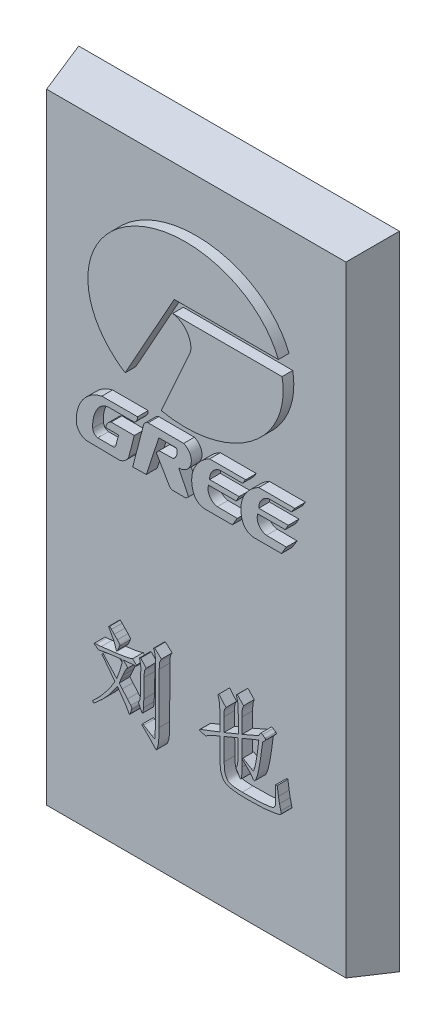
from build123d import *

# Parameters (mm, degrees)
EXTRUDE_3_DEPTH     = 1
SKETCH_5_R          = 5.5
CUT_EXTRUDE_1_DEPTH = 2
EXTRUDE_4_DEPTH     = 1
EXTRUDE_5_DEPTH     = 1


with BuildPart() as part:
    # 草图1 → 放样1 section 0
    with BuildSketch(Plane.XY):
        with BuildLine():
            Line((-15, -30), (15, -30))
            Line((15, -30), (15, 30))
            Line((15, 30), (-15, 30))
            Line((-15, 30), (-15, -30))
        make_face()
    # 草图2 → 放样1 section 1
    with BuildSketch(Plane.XY.offset(4)):
        with BuildLine():
            Line((-14, -29), (14, -29))
            Line((14, -29), (14, 29))
            Line((14, 29), (-14, 29))
            Line((-14, 29), (-14, -29))
        make_face()
    loft()

    # 草图4 → 凸台-拉伸3 (add)
    with BuildSketch(Plane.XY.offset(4)):
        with BuildLine():
            Line((-8.701981675, -17.388663968), (-8.617600682, -17.301725975))
            add(Edge.make_bspline(
                [(-8.617600682, -17.301725975), (-8.6150409, -17.299171838), (-8.607361553, -17.291509428), (-8.591939025, -17.275812111), (-8.567531532, -17.253359072), (-8.535647603, -17.222146979), (-8.494553267, -17.183979196), (-8.445204463, -17.138285053), (-8.386816782, -17.085481715), (-8.320576955, -17.024306793), (-8.246221878, -16.954193648), (-8.165436054, -16.873388622), (-8.079020214, -16.781225902), (-7.985588416, -16.679014982), (-7.886121691, -16.565894731), (-7.778094687, -16.443997551), (-7.666436292, -16.308719395), (-7.503591424, -16.115000087), (-7.298895179, -15.854174622), (-7.06301416, -15.517669226), (-6.830626913, -15.160132218), (-6.685534688, -14.909472229), (-6.611634349, -14.781802685)],
                knots=[0, 0, 0, 0, 0.067064899, 0.201194698, 0.408053647, 0.681959008, 1.028641223, 1.448132034, 1.929283414, 2.488604495, 3.120354818, 3.824536261, 4.607279378, 5.463251305, 6.392664243, 7.400870751, 8.483674113, 9.645406679, 12.094487374, 14.629448405, 17.264597856, 20, 20, 20, 20], degree=3))
            add(Edge.make_bspline(
                [(-6.611634349, -14.781802685), (-6.677355219, -14.694080325), (-6.801336137, -14.528594101), (-6.975046697, -14.293869871), (-7.128052851, -14.089741633), (-7.260480444, -13.915569528), (-7.369897523, -13.770279599), (-7.457376329, -13.654282983), (-7.526217285, -13.570571896), (-7.582699071, -13.497799136), (-7.635586412, -13.437186854), (-7.679234592, -13.378243521), (-7.712283472, -13.338932475), (-7.724576877, -13.315079833), (-7.729043256, -13.306413808)],
                knots=[0, 0, 0, 0, 2.13149326, 4.021013283, 5.678471046, 7.092298062, 8.275727547, 9.215558715, 9.917047241, 10.382981583, 11.006899411, 11.479347563, 11.810839116, 12, 12, 12, 12], degree=3))
            Line((-7.729043256, -13.306413808), (-7.824930748, -13.177285319))
            Line((-7.824930748, -13.177285319), (-7.729043256, -13.073726827))
            Line((-7.729043256, -13.073726827), (-7.644662263, -13.15938632))
            add(Edge.make_bspline(
                [(-7.644662263, -13.15938632), (-7.629282451, -13.175972122), (-7.591954382, -13.216227229), (-7.527305195, -13.288297956), (-7.440557184, -13.379422665), (-7.302378255, -13.536292511), (-7.104572099, -13.745740062), (-6.905065826, -13.963796689), (-6.747802954, -14.136718021), (-6.635049858, -14.252099447), (-6.536865705, -14.358806964), (-6.47286159, -14.423973045), (-6.442872363, -14.454506712)],
                knots=[0, 0, 0, 0, 0.384045172, 0.932109217, 1.643764177, 2.519898478, 4.481024401, 6.534588103, 7.538259206, 8.449228042, 9.273383417, 10, 10, 10, 10], degree=3))
            add(Edge.make_bspline(
                [(-6.442872363, -14.454506712), (-6.405201527, -14.35911478), (-6.332905522, -14.176043302), (-6.231843181, -13.912276932), (-6.149864716, -13.668866252), (-6.078665366, -13.450308489), (-6.024339358, -13.258168598), (-5.98424666, -13.096326335), (-5.956943752, -12.966798323), (-5.95252254, -12.890132643), (-5.950649904, -12.857660345)],
                knots=[0, 0, 0, 0, 1.468618142, 2.818499293, 4.043910366, 5.145864078, 6.10981738, 6.901638294, 7.534781031, 8, 8, 8, 8], degree=3))
            Line((-5.950649904, -12.857660345), (-5.950649904, -12.667163861))
            Line((-5.950649904, -12.667163861), (-6.972171319, -12.788621351))
            Line((-6.972171319, -12.788621351), (-7.451608779, -12.857660345))
            Line((-7.451608779, -12.857660345), (-7.956616237, -12.952269337))
            Line((-7.956616237, -12.952269337), (-8.16117622, -12.995738334))
            Line((-8.16117622, -12.995738334), (-8.232772214, -12.935648839))
            Line((-8.232772214, -12.935648839), (-8.485915193, -12.745152355))
            add(Edge.make_bspline(
                [(-8.485915193, -12.745152355), (-8.501489303, -12.73490888), (-8.526447886, -12.718493008), (-8.558458879, -12.694799587), (-8.557568147, -12.661889169), (-8.50827822, -12.649271695), (-8.449453901, -12.63496461), (-8.393937078, -12.628338983), (-8.365736203, -12.624973365)],
                knots=[0, 0, 0, 0, 1.118768377, 1.792903396, 2.169548065, 2.763492425, 4.355951528, 6, 6, 6, 6], degree=3))
            Line((-8.365736203, -12.624973365), (-7.885020243, -12.590453867))
            add(Edge.make_bspline(
                [(-7.885020243, -12.590453867), (-7.78272737, -12.578629672), (-7.574258285, -12.5545324), (-7.256024754, -12.515654208), (-6.925643087, -12.476441077), (-6.701543082, -12.448642762), (-6.587342851, -12.43447688)],
                knots=[0, 0, 0, 0, 0.945420497, 1.926731945, 2.943473063, 4, 4, 4, 4], degree=3))
            add(Edge.make_bspline(
                [(-6.587342851, -12.43447688), (-6.495657729, -12.423413493), (-6.318882537, -12.402082524), (-6.064664904, -12.364158296), (-5.830515798, -12.327688901), (-5.617264447, -12.28984122), (-5.424834911, -12.249462361), (-5.25244094, -12.211336739), (-5.101225844, -12.169009917), (-5.008293553, -12.13818563), (-4.964926486, -12.123801406)],
                knots=[0, 0, 0, 0, 1.33948248, 2.582613925, 3.727962399, 4.776813962, 5.723648299, 6.579883267, 7.337299279, 8, 8, 8, 8], degree=3))
            Line((-4.964926486, -12.123801406), (-4.592883017, -12.44342638))
            add(Edge.make_bspline(
                [(-4.592883017, -12.44342638), (-4.586313661, -12.454610374), (-4.573704208, -12.476077324), (-4.578676747, -12.511884126), (-4.596688819, -12.541911053), (-4.618071593, -12.545302265), (-4.628681014, -12.546984871)],
                knots=[0, 0, 0, 0, 1.123791349, 2.157044512, 3.08558681, 4, 4, 4, 4], degree=3))
            Line((-4.628681014, -12.546984871), (-5.193777967, -12.590453867))
            Line((-5.193777967, -12.590453867), (-5.793394417, -12.650543362))
            Line((-5.793394417, -12.650543362), (-5.409844449, -13.099296825))
            add(Edge.make_bspline(
                [(-5.409844449, -13.099296825), (-5.449499903, -13.136079122), (-5.524000558, -13.205181979), (-5.587303376, -13.301744233), (-5.61998484, -13.37159487), (-5.641445696, -13.416701743), (-5.666890063, -13.471734749), (-5.696865722, -13.536256466), (-5.729756683, -13.61142488), (-5.766306518, -13.697074488), (-5.809177744, -13.791622756), (-5.838230924, -13.858260359), (-5.853483912, -13.893245259)],
                knots=[0, 0, 0, 0, 1.762639404, 3.311468555, 3.728776672, 4.283189535, 4.943599157, 5.710021754, 6.607881863, 7.624557154, 8.752886879, 10, 10, 10, 10], degree=3))
            Line((-5.853483912, -13.893245259), (-6.082335393, -14.411037716))
            Line((-6.082335393, -14.411037716), (-6.214020882, -14.712763691))
            Line((-6.214020882, -14.712763691), (-5.926358406, -15.049009163))
            Line((-5.926358406, -15.049009163), (-5.434135947, -15.610270616))
            Line((-5.434135947, -15.610270616), (-5.120903473, -15.973364586))
            add(Edge.make_bspline(
                [(-5.120903473, -15.973364586), (-5.108508398, -15.990363114), (-5.086163173, -16.021007216), (-5.056993841, -16.062275096), (-5.040222812, -16.096032898), (-5.029672316, -16.123584455), (-5.031655384, -16.152962114), (-5.034721662, -16.189376311), (-5.04632312, -16.236994653), (-5.055631797, -16.272143528), (-5.060813978, -16.291711059)],
                knots=[0, 0, 0, 0, 1.455215602, 2.623390349, 3.479583614, 4.066449285, 4.626074215, 5.48479686, 6.599775501, 8, 8, 8, 8], degree=3))
            Line((-5.060813978, -16.291711059), (-5.169486469, -16.663754528))
            add(Edge.make_bspline(
                [(-5.169486469, -16.663754528), (-5.174174993, -16.677157718), (-5.18246774, -16.700864381), (-5.198745873, -16.729886481), (-5.216901029, -16.749122095), (-5.238951481, -16.755125572), (-5.261594893, -16.748983909), (-5.282282348, -16.729450325), (-5.305362329, -16.7015698), (-5.3182664, -16.677293999), (-5.325463456, -16.663754528)],
                knots=[0, 0, 0, 0, 1.365122435, 2.414536923, 3.199116316, 3.836643909, 4.513934304, 5.360547298, 6.527884014, 8, 8, 8, 8], degree=3))
            Line((-5.325463456, -16.663754528), (-5.421350948, -16.482207543))
            Line((-5.421350948, -16.482207543), (-5.565821436, -16.215001065))
            add(Edge.make_bspline(
                [(-5.565821436, -16.215001065), (-5.572208548, -16.205622117), (-5.588244401, -16.182074784), (-5.616983427, -16.140250866), (-5.658060685, -16.086621593), (-5.705063521, -16.017726276), (-5.763659301, -15.936783591), (-5.830878889, -15.842211073), (-5.90903839, -15.735248117), (-5.992876265, -15.619552174), (-6.075177782, -15.503789732), (-6.150436469, -15.397555707), (-6.216408063, -15.305904078), (-6.26928579, -15.226623912), (-6.312977006, -15.16243407), (-6.347040873, -15.11293019), (-6.368573488, -15.076247309), (-6.378991259, -15.056277349), (-6.382782868, -15.049009163)],
                knots=[0, 0, 0, 0, 0.382459276, 0.960224421, 1.710024245, 2.658454337, 3.770494442, 5.077894009, 6.569008607, 8.235429148, 9.893471766, 11.356158959, 12.623493842, 13.699131709, 14.567622413, 15.240873571, 15.723711415, 16, 16, 16, 16], degree=3))
            add(Edge.make_bspline(
                [(-6.382782868, -15.049009163), (-6.416909498, -15.100552505), (-6.482944033, -15.200288127), (-6.578062572, -15.345140635), (-6.670026744, -15.477861724), (-6.753098386, -15.60222334), (-6.833596009, -15.714430579), (-6.905249148, -15.8183162), (-6.973635526, -15.91004722), (-7.058115277, -16.023697045), (-7.173217897, -16.167150414), (-7.334311928, -16.346177935), (-7.520572626, -16.54609202), (-7.728276888, -16.75445262), (-7.936900177, -16.959762036), (-8.134192485, -17.142216407), (-8.308601908, -17.29845862), (-8.42121459, -17.389077999), (-8.473130194, -17.430854464)],
                knots=[0, 0, 0, 0, 0.931745548, 1.802914179, 2.611776586, 3.365396291, 4.056858392, 4.693065683, 5.267339538, 5.781210556, 6.827513186, 8.037874439, 9.410316573, 10.945546555, 12.471773758, 13.821678912, 14.99577158, 16, 16, 16, 16], degree=3))
            Line((-8.473130194, -17.430854464), (-8.606094183, -17.534412955))
            Line((-8.606094183, -17.534412955), (-8.701981675, -17.388663968))
        make_face()
        with BuildLine():
            Line((-7.211250799, -10.630513531), (-7.103856808, -10.553803537))
            Line((-7.103856808, -10.553803537), (-6.935094822, -10.726401023))
            Line((-6.935094822, -10.726401023), (-6.671723844, -10.993607501))
            Line((-6.671723844, -10.993607501), (-6.382782868, -11.295333475))
            add(Edge.make_bspline(
                [(-6.382782868, -11.295333475), (-6.364016122, -11.315776091), (-6.328925502, -11.354000303), (-6.279962873, -11.407778928), (-6.238808393, -11.454933426), (-6.206100395, -11.495820497), (-6.179781755, -11.528336484), (-6.163263547, -11.554924513), (-6.151359602, -11.573453422), (-6.145792904, -11.602262853), (-6.166926085, -11.650051026), (-6.181777032, -11.692273105), (-6.191007884, -11.71851694)],
                knots=[0, 0, 0, 0, 1.619185606, 3.027601398, 4.244025609, 5.269295413, 6.084975465, 6.67813271, 7.10086228, 7.354451259, 8.355615234, 10, 10, 10, 10], degree=3))
            Line((-6.191007884, -11.71851694), (-6.311186874, -12.029192414))
            add(Edge.make_bspline(
                [(-6.311186874, -12.029192414), (-6.321417975, -12.053246865), (-6.339637715, -12.096083488), (-6.369175367, -12.150574851), (-6.394959287, -12.188922038), (-6.420692917, -12.212351984), (-6.449964905, -12.215095714), (-6.472643068, -12.194654532), (-6.489438739, -12.160245395), (-6.497947711, -12.131683057), (-6.502961858, -12.114851907)],
                knots=[0, 0, 0, 0, 1.766026744, 3.144973943, 4.176047435, 4.895969722, 5.415113065, 5.991050895, 6.816171035, 8, 8, 8, 8], degree=3))
            Line((-6.502961858, -12.114851907), (-6.527253356, -12.029192414))
            add(Edge.make_bspline(
                [(-6.527253356, -12.029192414), (-6.565462786, -11.913018959), (-6.64149182, -11.681857287), (-6.749621634, -11.463861832), (-6.803409333, -11.35542297)],
                knots=[0, 0, 0, 0, 1.005127315, 2, 2, 2, 2], degree=3))
            Line((-6.803409333, -11.35542297), (-6.972171319, -11.053696996))
            add(Edge.make_bspline(
                [(-6.972171319, -11.053696996), (-6.993300524, -11.01673679), (-7.030051629, -10.952450019), (-7.07406915, -10.869103457), (-7.103723446, -10.815099763), (-7.112566488, -10.786565613), (-7.115363307, -10.777541019)],
                knots=[0, 0, 0, 0, 1.639141311, 2.851042099, 3.636615117, 4, 4, 4, 4], degree=3))
            Line((-7.115363307, -10.777541019), (-7.211250799, -10.630513531))
        make_face()
        with BuildLine():
            Line((-4.31544854, -11.727466439), (-4.19526955, -11.675047944))
            Line((-4.19526955, -11.675047944), (-3.691540592, -12.245258896))
            add(Edge.make_bspline(
                [(-3.691540592, -12.245258896), (-3.709810323, -12.2727357), (-3.743306609, -12.323112515), (-3.783569559, -12.394330478), (-3.813704395, -12.452101199), (-3.834694025, -12.516023227), (-3.847448468, -12.59699214), (-3.86001522, -12.684347934), (-3.866041286, -12.771519098), (-3.870153354, -12.858037951), (-3.87038165, -12.963355521), (-3.871309223, -13.040061953), (-3.871809077, -13.081397827)],
                knots=[0, 0, 0, 0, 1.131244594, 2.0740586, 2.806258543, 3.36096166, 4.37296763, 5.611338802, 6.388280779, 7.368648685, 8.582006723, 10, 10, 10, 10], degree=3))
            Line((-3.871809077, -13.081397827), (-3.907607074, -14.859791178))
            Line((-3.907607074, -14.859791178), (-3.943405071, -15.584700618))
            add(Edge.make_bspline(
                [(-3.943405071, -15.584700618), (-3.945337151, -15.617956796), (-3.948981312, -15.680682431), (-3.95706597, -15.768414138), (-3.964171003, -15.844825772), (-3.973350685, -15.90913213), (-3.981514107, -15.961795872), (-3.991691865, -16.002621639), (-4.002479425, -16.031402593), (-4.01557264, -16.054962993), (-4.04649104, -16.064029303), (-4.079703401, -16.034802266), (-4.114163474, -15.988274594), (-4.135459361, -15.945855862), (-4.147965054, -15.92094609)],
                knots=[0, 0, 0, 0, 1.76302463, 3.325302124, 4.663004508, 5.824175704, 6.762377734, 7.484540761, 8.041647273, 8.39829817, 8.869293458, 9.507688602, 10.536427081, 12, 12, 12, 12], degree=3))
            Line((-4.147965054, -15.92094609), (-4.255359045, -15.713829107))
            Line((-4.255359045, -15.713829107), (-4.352525037, -15.532282122))
            add(Edge.make_bspline(
                [(-4.352525037, -15.532282122), (-4.365405618, -15.507749536), (-4.386757968, -15.467081464), (-4.402824564, -15.412835847), (-4.395966719, -15.373877463), (-4.383846398, -15.34036551), (-4.365738625, -15.298101457), (-4.326896416, -15.231664451), (-4.282712631, -15.130473075), (-4.25294185, -14.987201603), (-4.235786887, -14.823160753), (-4.233540193, -14.705998092), (-4.232346047, -14.643724696)],
                knots=[0, 0, 0, 0, 0.901925096, 1.495136018, 1.774437093, 2.167492218, 2.649873968, 3.26160492, 4.659748266, 6.204185153, 7.982477734, 10, 10, 10, 10], degree=3))
            Line((-4.232346047, -14.643724696), (-4.19526955, -12.814191349))
            Line((-4.19526955, -12.814191349), (-4.183763051, -12.44342638))
            add(Edge.make_bspline(
                [(-4.183763051, -12.44342638), (-4.18831572, -12.402924774), (-4.198826597, -12.309417557), (-4.215744817, -12.184916485), (-4.235127336, -12.066005847), (-4.255291323, -11.96181072), (-4.282481032, -11.84759475), (-4.304121749, -11.768739449), (-4.31544854, -11.727466439)],
                knots=[0, 0, 0, 0, 1.006347927, 2.323384265, 3.101860361, 3.981004873, 4.943254252, 6, 6, 6, 6], degree=3))
        make_face()
        with BuildLine():
            Line((-2.886085659, -10.216279565), (-2.260899212, -10.795440017))
            add(Edge.make_bspline(
                [(-2.260899212, -10.795440017), (-2.27897721, -10.825593177), (-2.31186996, -10.88045657), (-2.353740762, -10.955684025), (-2.385079585, -11.013972945), (-2.406156719, -11.061201132), (-2.418307524, -11.107926684), (-2.429878104, -11.162874149), (-2.439530387, -11.231674601), (-2.451791638, -11.345356064), (-2.462447745, -11.509089806), (-2.464411029, -11.645623695), (-2.465459195, -11.71851694)],
                knots=[0, 0, 0, 0, 1.09355359, 1.989710599, 2.677512757, 3.152714002, 3.593377568, 4.175755165, 4.899414449, 5.752884475, 7.732533383, 10, 10, 10, 10], degree=3))
            Line((-2.465459195, -11.71851694), (-2.489750693, -16.464308545))
            add(Edge.make_bspline(
                [(-2.489750693, -16.464308545), (-2.489682191, -16.492009645), (-2.489529374, -16.553807072), (-2.490975351, -16.656519076), (-2.4938808, -16.778813349), (-2.496965577, -16.96890006), (-2.502164021, -17.223356379), (-2.509750918, -17.482641294), (-2.523924139, -17.690403365), (-2.543112578, -17.841690607), (-2.577602355, -17.986608757), (-2.61808336, -18.120197835), (-2.659407718, -18.233941254), (-2.695694125, -18.314965002), (-2.715146911, -18.36969669), (-2.735761473, -18.38529897), (-2.741615172, -18.389729384)],
                knots=[0, 0, 0, 0, 0.591697287, 1.319996994, 2.194077997, 3.204678908, 5.380780365, 7.630722164, 8.744310266, 9.828297922, 10.883818306, 11.920525732, 12.813365975, 13.454079988, 13.844980897, 14, 14, 14, 14], degree=3))
            add(Edge.make_bspline(
                [(-2.741615172, -18.389729384), (-2.748580604, -18.386552763), (-2.770203473, -18.376691542), (-2.805730246, -18.342781364), (-2.857676356, -18.290296374), (-2.898439287, -18.248716896), (-2.921883657, -18.224802898)],
                knots=[0, 0, 0, 0, 0.372665578, 1.156869871, 2.364803703, 4, 4, 4, 4], degree=3))
            Line((-2.921883657, -18.224802898), (-3.35529512, -17.750479437))
            Line((-3.35529512, -17.750479437), (-3.967696569, -17.154698487))
            Line((-3.967696569, -17.154698487), (-4.099382058, -17.008949499))
            Line((-4.099382058, -17.008949499), (-4.003494566, -16.905391008))
            Line((-4.003494566, -16.905391008), (-3.907607074, -16.974430002))
            Line((-3.907607074, -16.974430002), (-3.137950139, -17.448753463))
            add(Edge.make_bspline(
                [(-3.137950139, -17.448753463), (-3.107846641, -17.467453432), (-3.055614578, -17.499899429), (-2.987095797, -17.54194895), (-2.943047018, -17.562424533), (-2.912447329, -17.578564787), (-2.894380813, -17.563642034), (-2.884389813, -17.541037572), (-2.870955086, -17.507974371), (-2.865124564, -17.480861102), (-2.861794162, -17.465373961)],
                knots=[0, 0, 0, 0, 2.231975484, 3.872662471, 4.948167798, 5.447359977, 5.773533116, 6.264068126, 7.008433082, 8, 8, 8, 8], degree=3))
            add(Edge.make_bspline(
                [(-2.861794162, -17.465373961), (-2.858514906, -17.447512726), (-2.850750002, -17.405219364), (-2.858581596, -17.328530112), (-2.859413733, -17.227473124), (-2.851781312, -17.137658333), (-2.847727937, -17.0638988), (-2.843092015, -17.012428916), (-2.84163978, -16.949676316), (-2.836799089, -16.876886425), (-2.834870732, -16.792882265), (-2.832612814, -16.698680605), (-2.827953876, -16.593893276), (-2.826668572, -16.520567804), (-2.825996165, -16.482207543)],
                knots=[0, 0, 0, 0, 0.661127957, 1.565475392, 2.796625909, 4.357721855, 4.857348772, 5.497957161, 6.246587067, 7.151605532, 8.164975693, 9.318533995, 10.597189571, 12, 12, 12, 12], degree=3))
            Line((-2.825996165, -16.482207543), (-2.801704667, -11.545919455))
            add(Edge.make_bspline(
                [(-2.801704667, -11.545919455), (-2.801760094, -11.519481806), (-2.801871949, -11.466129504), (-2.807924708, -11.396797206), (-2.810607971, -11.332810947), (-2.815391131, -11.270252602), (-2.816801137, -11.193025953), (-2.822487079, -11.073272995), (-2.829012882, -10.921239192), (-2.843980556, -10.769848285), (-2.868264302, -10.646533474), (-2.89965208, -10.540449213), (-2.942670187, -10.417885881), (-2.976551583, -10.331655482), (-2.99475815, -10.28531856)],
                knots=[0, 0, 0, 0, 0.739991118, 1.493333668, 1.947445289, 2.533295858, 3.249720848, 4.109699155, 5.890394751, 7.51137051, 8.363279193, 9.405830689, 10.605992517, 12, 12, 12, 12], degree=3))
            Line((-2.99475815, -10.28531856), (-2.886085659, -10.216279565))
        make_face()
        with BuildLine():
            Line((3.210824632, -13.962284253), (3.210824632, -12.374387385))
            add(Edge.make_bspline(
                [(3.210824632, -12.374387385), (3.209126434, -12.271656981), (3.205655579, -12.06169196), (3.187606357, -11.795820456), (3.159876337, -11.575337912), (3.126662955, -11.402164237), (3.07905803, -11.224205556), (3.038507103, -11.105465778), (3.017771149, -11.044747496)],
                knots=[0, 0, 0, 0, 1.368881025, 2.797780605, 3.547867927, 4.328518173, 5.145277974, 6, 6, 6, 6], degree=3))
            Line((3.017771149, -11.044747496), (3.11493714, -10.941189005))
            Line((3.11493714, -10.941189005), (3.774643085, -11.700617942))
            add(Edge.make_bspline(
                [(3.774643085, -11.700617942), (3.758326503, -11.725251518), (3.72796582, -11.771087843), (3.687480246, -11.836093473), (3.657878594, -11.893945094), (3.627944587, -11.964767706), (3.607082509, -12.067445774), (3.592483254, -12.208639878), (3.584038135, -12.372591178), (3.583265573, -12.487741703), (3.582868101, -12.546984871)],
                knots=[0, 0, 0, 0, 0.799333978, 1.487341208, 2.069922442, 2.555870397, 3.562491356, 4.885176502, 6.397471374, 8, 8, 8, 8], degree=3))
            Line((3.582868101, -12.546984871), (3.582868101, -13.824206265))
            Line((3.582868101, -13.824206265), (4.929128489, -13.262944811))
            Line((4.929128489, -13.262944811), (4.929128489, -11.753036437))
            add(Edge.make_bspline(
                [(4.929128489, -11.753036437), (4.92858556, -11.691244836), (4.927548375, -11.573201294), (4.927892338, -11.404804507), (4.921425798, -11.253992254), (4.915833818, -11.079927224), (4.901987045, -10.885380488), (4.875754526, -10.70123617), (4.846282377, -10.559098647), (4.815991848, -10.44684633), (4.781186889, -10.325153143), (4.751489744, -10.242540414), (4.736075005, -10.199659067)],
                knots=[0, 0, 0, 0, 1.176911092, 2.248311282, 3.206600744, 4.051334116, 5.565261425, 6.918565952, 7.590320494, 8.328559244, 9.132414199, 10, 10, 10, 10], degree=3))
            Line((4.736075005, -10.199659067), (4.831962497, -10.112721074))
            Line((4.831962497, -10.112721074), (5.421350948, -10.734072022))
            add(Edge.make_bspline(
                [(5.421350948, -10.734072022), (5.408322526, -10.770211237), (5.383317544, -10.839571927), (5.351239432, -10.940628433), (5.325704556, -11.034024238), (5.303827308, -11.126182054), (5.29141719, -11.231984471), (5.283519325, -11.364266474), (5.276614903, -11.530086504), (5.276786754, -11.652026137), (5.27688046, -11.71851694)],
                knots=[0, 0, 0, 0, 0.919393691, 1.76455914, 2.536580374, 3.236881176, 4.028858006, 5.081856361, 6.408805183, 8, 8, 8, 8], degree=3))
            Line((5.27688046, -11.71851694), (5.27688046, -13.124866823))
            Line((5.27688046, -13.124866823), (6.827700831, -12.452375879))
            Line((6.827700831, -12.452375879), (7.019475815, -12.158320903))
            add(Edge.make_bspline(
                [(7.019475815, -12.158320903), (7.026703946, -12.148697104), (7.041507275, -12.128987408), (7.086030215, -12.128122667), (7.134752872, -12.147887327), (7.168626298, -12.170689347), (7.188237801, -12.183890901)],
                knots=[0, 0, 0, 0, 0.71453755, 1.463384476, 2.53139035, 4, 4, 4, 4], degree=3))
            Line((7.188237801, -12.183890901), (7.44010228, -12.374387385))
            add(Edge.make_bspline(
                [(7.44010228, -12.374387385), (7.456409708, -12.388950822), (7.484511329, -12.414047126), (7.499338251, -12.463386598), (7.482078066, -12.498937399), (7.458599113, -12.532898791), (7.416909429, -12.570821509), (7.368574387, -12.61700621), (7.316558293, -12.66066125), (7.273659526, -12.702873709), (7.241348343, -12.736242921), (7.21701738, -12.763028278), (7.208110051, -12.796607746), (7.197737652, -12.840710682), (7.1853454, -12.906928354), (7.171491916, -12.995155013), (7.156693918, -13.104841442), (7.138517192, -13.236055278), (7.117949326, -13.388985313), (7.090185505, -13.615805341), (7.057078191, -13.895783521), (7.012200307, -14.20829562), (6.973202819, -14.482784302), (6.930564858, -14.72147271), (6.891685116, -14.932838148), (6.854222441, -15.124032539), (6.8204412, -15.299942354), (6.785589875, -15.460139588), (6.75147321, -15.607093542), (6.714601925, -15.742081558), (6.673630702, -15.866106051), (6.630965981, -15.977511831), (6.590073801, -16.073390324), (6.556322534, -16.151155796), (6.52798116, -16.209509469), (6.502502392, -16.25649485), (6.470291137, -16.298824211), (6.434831686, -16.300083455), (6.418580865, -16.300660558)],
                knots=[0, 0, 0, 0, 0.559111769, 0.963484084, 1.199679221, 1.54642562, 2.027141703, 2.640108529, 3.269336219, 3.773372396, 4.184380251, 4.473866774, 4.681914613, 5.06490853, 5.645540527, 6.411685309, 7.363818343, 8.492742829, 9.820197465, 11.333935145, 14.372292433, 17.073622702, 19.457084914, 21.504944609, 23.311490023, 24.986709407, 26.517821523, 27.920066707, 29.204667356, 30.399106788, 31.519103026, 32.563782659, 33.467986644, 34.199448975, 34.748689143, 35.126785844, 35.59981199, 36, 36, 36, 36], degree=3))
            add(Edge.make_bspline(
                [(6.418580865, -16.300660558), (6.409816095, -16.299120895), (6.389730733, -16.2955926), (6.361018096, -16.272946221), (6.329957172, -16.239895489), (6.309607694, -16.212298734), (6.298401875, -16.197102067)],
                knots=[0, 0, 0, 0, 0.646680353, 1.481933883, 2.613379931, 4, 4, 4, 4], degree=3))
            Line((6.298401875, -16.197102067), (5.973662902, -15.791817601))
            Line((5.973662902, -15.791817601), (5.613125932, -15.421052632))
            Line((5.613125932, -15.421052632), (5.301171958, -15.126997656))
            Line((5.301171958, -15.126997656), (5.372767952, -14.997869167))
            Line((5.372767952, -14.997869167), (6.178222885, -15.490091626))
            add(Edge.make_bspline(
                [(6.178222885, -15.490091626), (6.194648608, -15.501452728), (6.223636396, -15.521502575), (6.263939359, -15.544300169), (6.292140741, -15.559916984), (6.316588627, -15.565606088), (6.337826073, -15.551900936), (6.356216812, -15.525312045), (6.377768277, -15.484375663), (6.405013145, -15.426588416), (6.435086831, -15.342078206), (6.466498512, -15.224546279), (6.505581258, -15.071791979), (6.559629335, -14.822391743), (6.627938588, -14.494438642), (6.679128713, -14.166876704), (6.712451994, -13.922564919), (6.736216622, -13.763771542), (6.754851776, -13.626833399), (6.773152012, -13.502512968), (6.791650807, -13.370998623), (6.808587871, -13.212279497), (6.829172257, -13.017111291), (6.843144072, -12.874717856), (6.850713829, -12.79757085)],
                knots=[0, 0, 0, 0, 0.440323242, 0.777073662, 1.016577932, 1.15873692, 1.297439592, 1.538046727, 1.870179391, 2.315683085, 2.945720451, 3.843830757, 4.996709113, 6.421182702, 9.468416178, 12.379641864, 13.726774567, 14.903855726, 15.918856624, 16.773102867, 17.673862327, 18.846135373, 20.291275087, 22, 22, 22, 22], degree=3))
            Line((6.850713829, -12.79757085), (5.265373961, -13.444491796))
            Line((5.265373961, -13.444491796), (5.265373961, -15.791817601))
            add(Edge.make_bspline(
                [(5.265373961, -15.791817601), (5.265651609, -15.854466389), (5.266174824, -15.972525423), (5.262737996, -16.139142222), (5.260821378, -16.284490155), (5.256968943, -16.408939518), (5.252241525, -16.512134297), (5.245890952, -16.594396297), (5.239366722, -16.655676085), (5.228165992, -16.706277228), (5.212924944, -16.748283526), (5.195840814, -16.782707572), (5.178343387, -16.807366528), (5.163005445, -16.808881042), (5.15670147, -16.809503516)],
                knots=[0, 0, 0, 0, 2.150659061, 4.052827516, 5.720942216, 7.140763154, 8.327264278, 9.266458778, 9.974179908, 10.439139188, 11.045371919, 11.490336149, 11.790525499, 12, 12, 12, 12], degree=3))
            add(Edge.make_bspline(
                [(5.15670147, -16.809503516), (5.145084644, -16.806090327), (5.115477873, -16.797391438), (5.079860637, -16.750467384), (5.03411576, -16.687163889), (5.00555075, -16.633226562), (4.989217984, -16.602386533)],
                knots=[0, 0, 0, 0, 0.521855015, 1.330005405, 2.473363152, 4, 4, 4, 4], degree=3))
            Line((4.989217984, -16.602386533), (4.831962497, -16.318559557))
            add(Edge.make_bspline(
                [(4.831962497, -16.318559557), (4.816647756, -16.292605327), (4.789719584, -16.24696956), (4.754513798, -16.187356703), (4.736850566, -16.14424678), (4.726676087, -16.112382083), (4.737698822, -16.086419896), (4.74847026, -16.055251845), (4.766358044, -16.014895421), (4.792389019, -15.966324018), (4.818368235, -15.903962994), (4.840282152, -15.826694947), (4.859466062, -15.734353684), (4.874221519, -15.632559334), (4.888087211, -15.531143226), (4.897628983, -15.441089287), (4.906229205, -15.367479809), (4.910466321, -15.300917129), (4.912987062, -15.222899108), (4.915654365, -15.115933767), (4.916598437, -14.970595453), (4.916435041, -14.861069343), (4.91634349, -14.799701683)],
                knots=[0, 0, 0, 0, 1.153316831, 2.027896723, 2.626604535, 2.958707876, 3.24723816, 3.664596661, 4.233327129, 4.925102638, 5.771803346, 6.807388563, 7.988979107, 9.373009111, 10.736290758, 11.899678417, 12.832920397, 13.567268629, 14.447137605, 15.815272531, 17.655290347, 20, 20, 20, 20], degree=3))
            Line((4.91634349, -14.799701683), (4.91634349, -13.582569785))
            Line((4.91634349, -13.582569785), (3.5943746, -14.134881739))
            Line((3.5943746, -14.134881739), (3.607159599, -16.188152568))
            add(Edge.make_bspline(
                [(3.607159599, -16.188152568), (3.609155134, -16.284053774), (3.613328035, -16.484594624), (3.628018181, -16.739684973), (3.658403283, -16.954775715), (3.708894856, -17.120409554), (3.779909349, -17.287863294), (3.8493934, -17.431707783), (3.937255351, -17.541708253), (4.041768254, -17.608686369), (4.174288903, -17.66793349), (4.339417769, -17.712353392), (4.53435378, -17.751593078), (4.762088112, -17.774427082), (5.02090097, -17.7920111), (5.204392162, -17.793279457), (5.301171958, -17.793948434)],
                knots=[0, 0, 0, 0, 1.425456696, 2.980799826, 3.795017339, 4.646697254, 5.544056949, 6.498866747, 7.011340332, 7.612152063, 8.320781704, 9.164607943, 10.145811148, 11.273905285, 12.562160463, 14, 14, 14, 14], degree=3))
            add(Edge.make_bspline(
                [(5.301171958, -17.793948434), (5.470789115, -17.794515515), (5.804503094, -17.79563122), (6.297213468, -17.787554868), (6.774213208, -17.772892278), (7.15857007, -17.752473046), (7.447605944, -17.73307115), (7.6382032, -17.714011088), (7.8043043, -17.691920919), (7.945776182, -17.664672643), (8.063545394, -17.637033396), (8.156964339, -17.603728141), (8.228035826, -17.569073121), (8.286855914, -17.514670336), (8.330260992, -17.44272668), (8.374041165, -17.363231496), (8.402674496, -17.284695978), (8.409655582, -17.232450653), (8.413040699, -17.207116983)],
                knots=[0, 0, 0, 0, 2.420504351, 4.762231322, 7.03186758, 9.2303889, 10.254712443, 11.165461446, 11.963621161, 12.644686658, 13.221420043, 13.686975695, 14.059747789, 14.339570671, 14.816933281, 15.24945927, 15.636064052, 16, 16, 16, 16], degree=3))
            Line((8.413040699, -17.207116983), (8.425825698, -15.635840614))
            Line((8.425825698, -15.635840614), (8.569017686, -15.619220115))
            Line((8.569017686, -15.619220115), (8.689196676, -16.438738547))
            Line((8.689196676, -16.438738547), (8.786362668, -16.991050501))
            Line((8.786362668, -16.991050501), (8.906541658, -17.508842958))
            add(Edge.make_bspline(
                [(8.906541658, -17.508842958), (8.908298872, -17.526376634), (8.912419079, -17.567488534), (8.928010183, -17.628304071), (8.946344796, -17.68162792), (8.951917027, -17.713778718), (8.953846154, -17.72490944)],
                knots=[0, 0, 0, 0, 0.953220718, 2.235054002, 3.388969388, 4, 4, 4, 4], degree=3))
            add(Edge.make_bspline(
                [(8.953846154, -17.72490944), (8.950069463, -17.736983143), (8.941712863, -17.763698363), (8.904645101, -17.795045339), (8.856434737, -17.82724415), (8.789371367, -17.855267017), (8.707715764, -17.884867177), (8.608460275, -17.912549262), (8.492372402, -17.939047729), (8.317130483, -17.971835273), (8.091894188, -18.009785756), (7.825098208, -18.045368552), (7.569274082, -18.078985841), (7.359310107, -18.098316431), (7.186183001, -18.110551033), (7.041252135, -18.117909869), (6.879727276, -18.124408997), (6.70198161, -18.128874983), (6.507684288, -18.134990279), (6.29669265, -18.136283727), (6.069134417, -18.139943667), (5.911870583, -18.139416346), (5.830470914, -18.139143405)],
                knots=[0, 0, 0, 0, 0.232926519, 0.515391414, 0.878795428, 1.325768791, 1.869100865, 2.508894764, 3.255029941, 4.101143149, 5.850638678, 7.536402802, 9.14670046, 10.687374927, 11.488261288, 12.400303648, 13.407749454, 14.51872378, 15.733519881, 17.051853478, 18.474041082, 20, 20, 20, 20], degree=3))
            add(Edge.make_bspline(
                [(5.830470914, -18.139143405), (5.749499846, -18.139378112), (5.591382586, -18.13983644), (5.360320443, -18.136582645), (5.141722252, -18.126795164), (4.935319262, -18.116184546), (4.741261185, -18.099891372), (4.559842862, -18.07740414), (4.390691678, -18.054235165), (4.234594957, -18.024596436), (4.091014932, -17.991286754), (3.960984602, -17.94893976), (3.843915713, -17.899325014), (3.74012297, -17.84200252), (3.649680107, -17.778015545), (3.572517953, -17.706759318), (3.509301087, -17.627469309), (3.447456445, -17.513961696), (3.388881158, -17.37449272), (3.328227496, -17.217719964), (3.287009221, -17.074340979), (3.260759296, -16.939508324), (3.249330552, -16.801128193), (3.240759072, -16.64807565), (3.233684411, -16.473317947), (3.233784497, -16.349677339), (3.233837631, -16.28404006)],
                knots=[0, 0, 0, 0, 1.518911959, 2.966074195, 4.334239857, 5.623327299, 6.842892953, 7.986185861, 9.05230548, 10.044787367, 10.965795675, 11.815222499, 12.606695946, 13.347450692, 14.035144098, 14.679960432, 15.31171039, 15.927477056, 17.09794899, 18.147758735, 19.078945764, 19.892674845, 20.719956626, 21.68090022, 22.768855931, 24, 24, 24, 24], degree=3))
            Line((3.233837631, -16.28404006), (3.222331131, -14.289580226))
            add(Edge.make_bspline(
                [(3.222331131, -14.289580226), (3.159695497, -14.315601661), (3.040781697, -14.365003374), (2.871626836, -14.434819669), (2.722994747, -14.499134877), (2.593460017, -14.553589381), (2.484240181, -14.601604607), (2.394031785, -14.640580012), (2.323583949, -14.672308254), (2.254988923, -14.705658648), (2.17860888, -14.74665373), (2.088638186, -14.806853655), (1.989717119, -14.87517737), (1.923522055, -14.927171092), (1.888855743, -14.95440017)],
                knots=[0, 0, 0, 0, 1.631833046, 3.098036258, 4.40260852, 5.528124467, 6.478632526, 7.272971962, 7.892419543, 8.33722278, 9.108053839, 9.975462267, 10.9397509, 12, 12, 12, 12], degree=3))
            Line((1.888855743, -14.95440017), (1.383848285, -14.816322182))
            add(Edge.make_bspline(
                [(1.383848285, -14.816322182), (1.371256566, -14.813541672), (1.349110971, -14.808651471), (1.321910173, -14.794053216), (1.302807026, -14.775950203), (1.297801439, -14.751917852), (1.303225753, -14.727242926), (1.321967909, -14.705700487), (1.34822781, -14.684206509), (1.37110556, -14.674629187), (1.383848285, -14.669294694)],
                knots=[0, 0, 0, 0, 1.286068791, 2.261864203, 3.078608935, 3.825212105, 4.613490036, 5.528387975, 6.623331777, 8, 8, 8, 8], degree=3))
            Line((1.383848285, -14.669294694), (3.210824632, -13.962284253))
        make_face()
    extrude(amount=EXTRUDE_3_DEPTH)

    # 草图5 → 切除-拉伸1 (cut)
    with BuildSketch(Plane(origin=(0, 0, 0), x_dir=(-1, 0, 0), z_dir=(0, 0, -1))):
        Circle(SKETCH_5_R)
        with Locations((0, 18)):
            Circle(SKETCH_5_R)
        with Locations((0, -18)):
            Circle(SKETCH_5_R)
    extrude(amount=-CUT_EXTRUDE_1_DEPTH, mode=Mode.SUBTRACT)

    # 草图7 → 凸台-拉伸4 (add)
    with BuildSketch(Plane.XY.offset(4)):
        with BuildLine():
            Line((3.210824632, -13.962284253), (1.383848285, -14.669294694))
            add(Edge.make_bspline(
                [(1.383848285, -14.669294694), (1.37110556, -14.674629187), (1.34822781, -14.684206509), (1.321967909, -14.705700487), (1.303225753, -14.727242926), (1.297801439, -14.751917852), (1.302807026, -14.775950203), (1.321910173, -14.794053216), (1.349110971, -14.808651471), (1.371256566, -14.813541672), (1.383848285, -14.816322182)],
                knots=[0, 0, 0, 0, 0.172083528, 0.308951503, 0.423313745, 0.521848487, 0.615173883, 0.717266975, 0.839241401, 1, 1, 1, 1], degree=3))
            Line((1.383848285, -14.816322182), (1.888855743, -14.95440017))
            add(Edge.make_bspline(
                [(1.888855743, -14.95440017), (1.923522055, -14.927171092), (1.989717119, -14.87517737), (2.088638186, -14.806853655), (2.17860888, -14.74665373), (2.254988923, -14.705658648), (2.323583949, -14.672308254), (2.394031785, -14.640580012), (2.484240181, -14.601604607), (2.593460017, -14.553589381), (2.722994747, -14.499134877), (2.871626836, -14.434819669), (3.040781697, -14.365003374), (3.159695497, -14.315601661), (3.222331131, -14.289580226)],
                knots=[0, 0, 0, 0, 0.088354092, 0.168711478, 0.240995513, 0.305231435, 0.342298371, 0.393919003, 0.460113956, 0.539322961, 0.633115957, 0.741830312, 0.864013913, 1, 1, 1, 1], degree=3))
            Line((3.222331131, -14.289580226), (3.233837631, -16.28404006))
            add(Edge.make_bspline(
                [(3.233837631, -16.28404006), (3.233784497, -16.349677339), (3.233684411, -16.473317947), (3.240759072, -16.64807565), (3.249330552, -16.801128193), (3.260759296, -16.939508324), (3.287009221, -17.074340979), (3.328227496, -17.217719964), (3.388881158, -17.37449272), (3.447456445, -17.513961696), (3.509301087, -17.627469309), (3.572517953, -17.706759318), (3.649680107, -17.778015545), (3.74012297, -17.84200252), (3.843915713, -17.899325014), (3.960984602, -17.94893976), (4.091014932, -17.991286754), (4.234594957, -18.024596436), (4.390691678, -18.054235165), (4.559842862, -18.07740414), (4.741261185, -18.099891372), (4.935319262, -18.116184546), (5.141722252, -18.126795164), (5.360320443, -18.136582645), (5.591382586, -18.13983644), (5.749499846, -18.139378112), (5.830470914, -18.139143405)],
                knots=[0, 0, 0, 0, 0.05129767, 0.096629158, 0.136668474, 0.171138548, 0.205043927, 0.243843386, 0.287585459, 0.336355123, 0.362012067, 0.388334982, 0.415202329, 0.443856221, 0.474721002, 0.507699063, 0.543091847, 0.581467193, 0.622820605, 0.667242256, 0.71487946, 0.765694696, 0.819406673, 0.876413575, 0.936712002, 1, 1, 1, 1], degree=3))
            add(Edge.make_bspline(
                [(5.830470914, -18.139143405), (5.911870583, -18.139416346), (6.069134417, -18.139943667), (6.29669265, -18.136283727), (6.507684288, -18.134990279), (6.70198161, -18.128874983), (6.879727276, -18.124408997), (7.041252135, -18.117909869), (7.186183001, -18.110551033), (7.359310107, -18.098316431), (7.569274082, -18.078985841), (7.825098208, -18.045368552), (8.091894188, -18.009785756), (8.317130483, -17.971835273), (8.492372402, -17.939047729), (8.608460275, -17.912549262), (8.707715764, -17.884867177), (8.789371367, -17.855267017), (8.856434737, -17.82724415), (8.904645101, -17.795045339), (8.941712863, -17.763698363), (8.950069463, -17.736983143), (8.953846154, -17.72490944)],
                knots=[0, 0, 0, 0, 0.076297946, 0.147407326, 0.213324006, 0.274063811, 0.329612527, 0.379984818, 0.425586936, 0.465631254, 0.542664977, 0.62317986, 0.707468066, 0.794942843, 0.837248503, 0.874555262, 0.906544957, 0.93371156, 0.956060229, 0.974230429, 0.988353674, 1, 1, 1, 1], degree=3))
            add(Edge.make_bspline(
                [(8.953846154, -17.72490944), (8.951917027, -17.713778718), (8.946344796, -17.68162792), (8.928010183, -17.628304071), (8.912419079, -17.567488534), (8.908298872, -17.526376634), (8.906541658, -17.508842958)],
                knots=[0, 0, 0, 0, 0.152757653, 0.4412365, 0.76169482, 1, 1, 1, 1], degree=3))
            Line((8.906541658, -17.508842958), (8.786362668, -16.991050501))
            Line((8.786362668, -16.991050501), (8.689196676, -16.438738547))
            Line((8.689196676, -16.438738547), (8.569017686, -15.619220115))
            Line((8.569017686, -15.619220115), (8.425825698, -15.635840614))
            Line((8.425825698, -15.635840614), (8.413040699, -17.207116983))
            add(Edge.make_bspline(
                [(8.413040699, -17.207116983), (8.409655582, -17.232450653), (8.402674496, -17.284695978), (8.374041165, -17.363231496), (8.330260992, -17.44272668), (8.286855914, -17.514670336), (8.228035826, -17.569073121), (8.156964339, -17.603728141), (8.063545394, -17.637033396), (7.945776182, -17.664672643), (7.8043043, -17.691920919), (7.6382032, -17.714011088), (7.447605944, -17.73307115), (7.15857007, -17.752473046), (6.774213208, -17.772892278), (6.297213468, -17.787554868), (5.804503094, -17.79563122), (5.470789115, -17.794515515), (5.301171958, -17.793948434)],
                knots=[0, 0, 0, 0, 0.022745997, 0.046908796, 0.07394167, 0.103776833, 0.121265763, 0.144564019, 0.173661247, 0.209707084, 0.252273677, 0.30215866, 0.359080472, 0.423100694, 0.560508276, 0.702360542, 0.848718478, 1, 1, 1, 1], degree=3))
            add(Edge.make_bspline(
                [(5.301171958, -17.793948434), (5.204392162, -17.793279457), (5.02090097, -17.7920111), (4.762088112, -17.774427082), (4.53435378, -17.751593078), (4.339417769, -17.712353392), (4.174288903, -17.66793349), (4.041768254, -17.608686369), (3.937255351, -17.541708253), (3.8493934, -17.431707783), (3.779909349, -17.287863294), (3.708894856, -17.120409554), (3.658403283, -16.954775715), (3.628018181, -16.739684973), (3.613328035, -16.484594624), (3.609155134, -16.284053774), (3.607159599, -16.188152568)],
                knots=[0, 0, 0, 0, 0.102702824, 0.194721051, 0.275299204, 0.345385147, 0.40565845, 0.456274853, 0.499189976, 0.535795232, 0.603995932, 0.668093053, 0.728927333, 0.787085727, 0.898181665, 1, 1, 1, 1], degree=3))
            Line((3.607159599, -16.188152568), (3.5943746, -14.134881739))
            Line((3.5943746, -14.134881739), (4.91634349, -13.582569785))
            Line((4.91634349, -13.582569785), (4.91634349, -14.799701683))
            add(Edge.make_bspline(
                [(4.91634349, -14.799701683), (4.916435041, -14.861069343), (4.916598437, -14.970595453), (4.915654365, -15.115933767), (4.912987062, -15.222899108), (4.910466321, -15.300917129), (4.906229205, -15.367479809), (4.897628983, -15.441089287), (4.888087211, -15.531143226), (4.874221519, -15.632559334), (4.859466062, -15.734353684), (4.840282152, -15.826694947), (4.818368235, -15.903962994), (4.792389019, -15.966324018), (4.766358044, -16.014895421), (4.74847026, -16.055251845), (4.737698822, -16.086419896), (4.726676087, -16.112382083), (4.736850566, -16.14424678), (4.754513798, -16.187356703), (4.789719584, -16.24696956), (4.816647756, -16.292605327), (4.831962497, -16.318559557)],
                knots=[0, 0, 0, 0, 0.117235483, 0.209236373, 0.27764312, 0.321636569, 0.35835398, 0.405016079, 0.463185462, 0.531349544, 0.600551045, 0.659630572, 0.711409833, 0.753744868, 0.788333644, 0.816770167, 0.837638092, 0.852064606, 0.868669773, 0.898605164, 0.942334158, 1, 1, 1, 1], degree=3))
            Line((4.831962497, -16.318559557), (4.989217984, -16.602386533))
            add(Edge.make_bspline(
                [(4.989217984, -16.602386533), (5.00555075, -16.633226562), (5.03411576, -16.687163889), (5.079860637, -16.750467384), (5.115477873, -16.797391438), (5.145084644, -16.806090327), (5.15670147, -16.809503516)],
                knots=[0, 0, 0, 0, 0.381659212, 0.667498649, 0.869536246, 1, 1, 1, 1], degree=3))
            add(Edge.make_bspline(
                [(5.15670147, -16.809503516), (5.163005445, -16.808881042), (5.178343387, -16.807366528), (5.195840814, -16.782707572), (5.212924944, -16.748283526), (5.228165992, -16.706277228), (5.239366722, -16.655676085), (5.245890952, -16.594396297), (5.252241525, -16.512134297), (5.256968943, -16.408939518), (5.260821378, -16.284490155), (5.262737996, -16.139142222), (5.266174824, -15.972525423), (5.265651609, -15.854466389), (5.265373961, -15.791817601)],
                knots=[0, 0, 0, 0, 0.017456208, 0.042471988, 0.07955234, 0.130071734, 0.168818341, 0.227795102, 0.30606131, 0.404936404, 0.523254815, 0.662264374, 0.820778412, 1, 1, 1, 1], degree=3))
            Line((5.265373961, -15.791817601), (5.265373961, -13.444491796))
            Line((5.265373961, -13.444491796), (6.850713829, -12.79757085))
            add(Edge.make_bspline(
                [(6.850713829, -12.79757085), (6.843144072, -12.874717856), (6.829172257, -13.017111291), (6.808587871, -13.212279497), (6.791650807, -13.370998623), (6.773152012, -13.502512968), (6.754851776, -13.626833399), (6.736216622, -13.763771542), (6.712451994, -13.922564919), (6.679128713, -14.166876704), (6.627938588, -14.494438642), (6.559629335, -14.822391743), (6.505581258, -15.071791979), (6.466498512, -15.224546279), (6.435086831, -15.342078206), (6.405013145, -15.426588416), (6.377768277, -15.484375663), (6.356216812, -15.525312045), (6.337826073, -15.551900936), (6.316588627, -15.565606088), (6.292140741, -15.559916984), (6.263939359, -15.544300169), (6.223636396, -15.521502575), (6.194648608, -15.501452728), (6.178222885, -15.490091626)],
                knots=[0, 0, 0, 0, 0.077669314, 0.143357483, 0.196642622, 0.237586233, 0.276415608, 0.322552012, 0.376055701, 0.437289006, 0.569617446, 0.708128059, 0.772876858, 0.82528042, 0.866103616, 0.894741678, 0.914991846, 0.930088785, 0.941025473, 0.94733014, 0.953791912, 0.96467847, 0.979985307, 1, 1, 1, 1], degree=3))
            Line((6.178222885, -15.490091626), (5.372767952, -14.997869167))
            Line((5.372767952, -14.997869167), (5.301171958, -15.126997656))
            Line((5.301171958, -15.126997656), (5.613125932, -15.421052632))
            Line((5.613125932, -15.421052632), (5.973662902, -15.791817601))
            Line((5.973662902, -15.791817601), (6.298401875, -16.197102067))
            add(Edge.make_bspline(
                [(6.298401875, -16.197102067), (6.309607694, -16.212298734), (6.329957172, -16.239895489), (6.361018096, -16.272946221), (6.389730733, -16.2955926), (6.409816095, -16.299120895), (6.418580865, -16.300660558)],
                knots=[0, 0, 0, 0, 0.346655017, 0.629516529, 0.838329912, 1, 1, 1, 1], degree=3))
            add(Edge.make_bspline(
                [(6.418580865, -16.300660558), (6.434831686, -16.300083455), (6.470291137, -16.298824211), (6.502502392, -16.25649485), (6.52798116, -16.209509469), (6.556322534, -16.151155796), (6.590073801, -16.073390324), (6.630965981, -15.977511831), (6.673630702, -15.866106051), (6.714601925, -15.742081558), (6.75147321, -15.607093542), (6.785589875, -15.460139588), (6.8204412, -15.299942354), (6.854222441, -15.124032539), (6.891685116, -14.932838148), (6.930564858, -14.72147271), (6.973202819, -14.482784302), (7.012200307, -14.20829562), (7.057078191, -13.895783521), (7.090185505, -13.615805341), (7.117949326, -13.388985313), (7.138517192, -13.236055278), (7.156693918, -13.104841442), (7.171491916, -12.995155013), (7.1853454, -12.906928354), (7.197737652, -12.840710682), (7.208110051, -12.796607746), (7.21701738, -12.763028278), (7.241348343, -12.736242921), (7.273659526, -12.702873709), (7.316558293, -12.66066125), (7.368574387, -12.61700621), (7.416909429, -12.570821509), (7.458599113, -12.532898791), (7.482078066, -12.498937399), (7.499338251, -12.463386598), (7.484511329, -12.414047126), (7.456409708, -12.388950822), (7.44010228, -12.374387385)],
                knots=[0, 0, 0, 0, 0.011116334, 0.024255949, 0.034758635, 0.050015306, 0.070333704, 0.095450482, 0.12446936, 0.155580367, 0.18875924, 0.224442591, 0.263393847, 0.305924739, 0.35245861, 0.402640428, 0.459525419, 0.525732703, 0.600769655, 0.685168468, 0.727216737, 0.764090477, 0.79544949, 0.82189763, 0.84317943, 0.859308096, 0.869946816, 0.875725923, 0.883767215, 0.8951841, 0.909185105, 0.926663652, 0.943690508, 0.957043733, 0.966675577, 0.973236553, 0.984469118, 1, 1, 1, 1], degree=3))
            Line((7.44010228, -12.374387385), (7.188237801, -12.183890901))
            add(Edge.make_bspline(
                [(7.188237801, -12.183890901), (7.168626298, -12.170689347), (7.134752872, -12.147887327), (7.086030215, -12.128122667), (7.041507275, -12.128987408), (7.026703946, -12.148697104), (7.019475815, -12.158320903)],
                knots=[0, 0, 0, 0, 0.367152412, 0.634153881, 0.821365613, 1, 1, 1, 1], degree=3))
            Line((7.019475815, -12.158320903), (6.827700831, -12.452375879))
            Line((6.827700831, -12.452375879), (5.27688046, -13.124866823))
            Line((5.27688046, -13.124866823), (5.27688046, -11.71851694))
            add(Edge.make_bspline(
                [(5.27688046, -11.71851694), (5.276786754, -11.652026137), (5.276614903, -11.530086504), (5.283519325, -11.364266474), (5.29141719, -11.231984471), (5.303827308, -11.126182054), (5.325704556, -11.034024238), (5.351239432, -10.940628433), (5.383317544, -10.839571927), (5.408322526, -10.770211237), (5.421350948, -10.734072022)],
                knots=[0, 0, 0, 0, 0.198899352, 0.364767955, 0.496392749, 0.595389853, 0.682927453, 0.779430108, 0.885075789, 1, 1, 1, 1], degree=3))
            Line((5.421350948, -10.734072022), (4.831962497, -10.112721074))
            Line((4.831962497, -10.112721074), (4.736075005, -10.199659067))
            add(Edge.make_bspline(
                [(4.736075005, -10.199659067), (4.751489744, -10.242540414), (4.781186889, -10.325153143), (4.815991848, -10.44684633), (4.846282377, -10.559098647), (4.875754526, -10.70123617), (4.901987045, -10.885380488), (4.915833818, -11.079927224), (4.921425798, -11.253992254), (4.927892338, -11.404804507), (4.927548375, -11.573201294), (4.92858556, -11.691244836), (4.929128489, -11.753036437)],
                knots=[0, 0, 0, 0, 0.08675858, 0.167144076, 0.240967951, 0.308143405, 0.443473858, 0.594866588, 0.679339926, 0.775168872, 0.882308891, 1, 1, 1, 1], degree=3))
            Line((4.929128489, -11.753036437), (4.929128489, -13.262944811))
            Line((4.929128489, -13.262944811), (3.582868101, -13.824206265))
            Line((3.582868101, -13.824206265), (3.582868101, -12.546984871))
            add(Edge.make_bspline(
                [(3.582868101, -12.546984871), (3.583265573, -12.487741703), (3.584038135, -12.372591178), (3.592483254, -12.208639878), (3.607082509, -12.067445774), (3.627944587, -11.964767706), (3.657878594, -11.893945094), (3.687480246, -11.836093473), (3.72796582, -11.771087843), (3.758326503, -11.725251518), (3.774643085, -11.700617942)],
                knots=[0, 0, 0, 0, 0.200316078, 0.389352937, 0.554688581, 0.6805162, 0.741259695, 0.814082349, 0.900083253, 1, 1, 1, 1], degree=3))
            Line((3.774643085, -11.700617942), (3.11493714, -10.941189005))
            Line((3.11493714, -10.941189005), (3.017771149, -11.044747496))
            add(Edge.make_bspline(
                [(3.017771149, -11.044747496), (3.038507103, -11.105465778), (3.07905803, -11.224205556), (3.126662955, -11.402164237), (3.159876337, -11.575337912), (3.187606357, -11.795820456), (3.205655579, -12.06169196), (3.209126434, -12.271656981), (3.210824632, -12.374387385)],
                knots=[0, 0, 0, 0, 0.142453671, 0.278580305, 0.408688679, 0.533703232, 0.771853163, 1, 1, 1, 1], degree=3))
            Line((3.210824632, -12.374387385), (3.210824632, -13.962284253))
        make_face()
        with BuildLine():
            Line((-2.886085659, -10.216279565), (-2.99475815, -10.28531856))
            add(Edge.make_bspline(
                [(-2.99475815, -10.28531856), (-2.976551583, -10.331655482), (-2.942670187, -10.417885881), (-2.89965208, -10.540449213), (-2.868264302, -10.646533474), (-2.843980556, -10.769848285), (-2.829012882, -10.921239192), (-2.822487079, -11.073272995), (-2.816801137, -11.193025953), (-2.815391131, -11.270252602), (-2.810607971, -11.332810947), (-2.807924708, -11.396797206), (-2.801871949, -11.466129504), (-2.801760094, -11.519481806), (-2.801704667, -11.545919455)],
                knots=[0, 0, 0, 0, 0.11616729, 0.216180776, 0.303060067, 0.374052457, 0.509133771, 0.65752507, 0.729189929, 0.788892012, 0.837712893, 0.875555528, 0.938334073, 1, 1, 1, 1], degree=3))
            Line((-2.801704667, -11.545919455), (-2.825996165, -16.482207543))
            add(Edge.make_bspline(
                [(-2.825996165, -16.482207543), (-2.826668572, -16.520567804), (-2.827953876, -16.593893276), (-2.832612814, -16.698680605), (-2.834870732, -16.792882265), (-2.836799089, -16.876886425), (-2.84163978, -16.949676316), (-2.843092015, -17.012428916), (-2.847727937, -17.0638988), (-2.851781312, -17.137658333), (-2.859413733, -17.227473124), (-2.858581596, -17.328530112), (-2.850750002, -17.405219364), (-2.858514906, -17.447512726), (-2.861794162, -17.465373961)],
                knots=[0, 0, 0, 0, 0.116900869, 0.2234555, 0.319585359, 0.404032872, 0.479451078, 0.541836903, 0.595220936, 0.636856512, 0.766947841, 0.869543717, 0.944906004, 1, 1, 1, 1], degree=3))
            add(Edge.make_bspline(
                [(-2.861794162, -17.465373961), (-2.865124564, -17.480861102), (-2.870955086, -17.507974371), (-2.884389813, -17.541037572), (-2.894380813, -17.563642034), (-2.912447329, -17.578564787), (-2.943047018, -17.562424533), (-2.987095797, -17.54194895), (-3.055614578, -17.499899429), (-3.107846641, -17.467453432), (-3.137950139, -17.448753463)],
                knots=[0, 0, 0, 0, 0.123945865, 0.216991484, 0.278308361, 0.319080003, 0.381479025, 0.515917191, 0.721003064, 1, 1, 1, 1], degree=3))
            Line((-3.137950139, -17.448753463), (-3.907607074, -16.974430002))
            Line((-3.907607074, -16.974430002), (-4.003494566, -16.905391008))
            Line((-4.003494566, -16.905391008), (-4.099382058, -17.008949499))
            Line((-4.099382058, -17.008949499), (-3.967696569, -17.154698487))
            Line((-3.967696569, -17.154698487), (-3.35529512, -17.750479437))
            Line((-3.35529512, -17.750479437), (-2.921883657, -18.224802898))
            add(Edge.make_bspline(
                [(-2.921883657, -18.224802898), (-2.898439287, -18.248716896), (-2.857676356, -18.290296374), (-2.805730246, -18.342781364), (-2.770203473, -18.376691542), (-2.748580604, -18.386552763), (-2.741615172, -18.389729384)],
                knots=[0, 0, 0, 0, 0.408799074, 0.710782532, 0.906833606, 1, 1, 1, 1], degree=3))
            add(Edge.make_bspline(
                [(-2.741615172, -18.389729384), (-2.735761473, -18.38529897), (-2.715146911, -18.36969669), (-2.695694125, -18.314965002), (-2.659407718, -18.233941254), (-2.61808336, -18.120197835), (-2.577602355, -17.986608757), (-2.543112578, -17.841690607), (-2.523924139, -17.690403365), (-2.509750918, -17.482641294), (-2.502164021, -17.223356379), (-2.496965577, -16.96890006), (-2.4938808, -16.778813349), (-2.490975351, -16.656519076), (-2.489529374, -16.553807072), (-2.489682191, -16.492009645), (-2.489750693, -16.464308545)],
                knots=[0, 0, 0, 0, 0.011072793, 0.038994287, 0.084759573, 0.148533876, 0.222584407, 0.29797872, 0.37540641, 0.454948417, 0.615658545, 0.771094364, 0.843280143, 0.9057145, 0.957735908, 1, 1, 1, 1], degree=3))
            Line((-2.489750693, -16.464308545), (-2.465459195, -11.71851694))
            add(Edge.make_bspline(
                [(-2.465459195, -11.71851694), (-2.464411029, -11.645623695), (-2.462447745, -11.509089806), (-2.451791638, -11.345356064), (-2.439530387, -11.231674601), (-2.429878104, -11.162874149), (-2.418307524, -11.107926684), (-2.406156719, -11.061201132), (-2.385079585, -11.013972945), (-2.353740762, -10.955684025), (-2.31186996, -10.88045657), (-2.27897721, -10.825593177), (-2.260899212, -10.795440017)],
                knots=[0, 0, 0, 0, 0.226746662, 0.424711552, 0.510058555, 0.582424483, 0.640662243, 0.6847286, 0.732248724, 0.80102894, 0.890644641, 1, 1, 1, 1], degree=3))
            Line((-2.260899212, -10.795440017), (-2.886085659, -10.216279565))
        make_face()
        with BuildLine():
            Line((-4.183763051, -12.44342638), (-4.19526955, -12.814191349))
            Line((-4.19526955, -12.814191349), (-4.232346047, -14.643724696))
            add(Edge.make_bspline(
                [(-4.232346047, -14.643724696), (-4.233540193, -14.705998092), (-4.235786887, -14.823160753), (-4.25294185, -14.987201603), (-4.282712631, -15.130473075), (-4.326896416, -15.231664451), (-4.365738625, -15.298101457), (-4.383846398, -15.34036551), (-4.395966719, -15.373877463), (-4.402824564, -15.412835847), (-4.386757968, -15.467081464), (-4.365405618, -15.507749536), (-4.352525037, -15.532282122)],
                knots=[0, 0, 0, 0, 0.201752227, 0.379581485, 0.534025173, 0.673839508, 0.735012603, 0.783250778, 0.822556291, 0.850486398, 0.90980749, 1, 1, 1, 1], degree=3))
            Line((-4.352525037, -15.532282122), (-4.255359045, -15.713829107))
            Line((-4.255359045, -15.713829107), (-4.147965054, -15.92094609))
            add(Edge.make_bspline(
                [(-4.147965054, -15.92094609), (-4.135459361, -15.945855862), (-4.114163474, -15.988274594), (-4.079703401, -16.034802266), (-4.04649104, -16.064029303), (-4.01557264, -16.054962993), (-4.002479425, -16.031402593), (-3.991691865, -16.002621639), (-3.981514107, -15.961795872), (-3.973350685, -15.90913213), (-3.964171003, -15.844825772), (-3.95706597, -15.768414138), (-3.948981312, -15.680682431), (-3.945337151, -15.617956796), (-3.943405071, -15.584700618)],
                knots=[0, 0, 0, 0, 0.12196441, 0.207692616, 0.260892212, 0.300141819, 0.329862727, 0.37628827, 0.436468522, 0.514652025, 0.611416291, 0.72289149, 0.853081281, 1, 1, 1, 1], degree=3))
            Line((-3.943405071, -15.584700618), (-3.907607074, -14.859791178))
            Line((-3.907607074, -14.859791178), (-3.871809077, -13.081397827))
            add(Edge.make_bspline(
                [(-3.871809077, -13.081397827), (-3.871309223, -13.040061953), (-3.87038165, -12.963355521), (-3.870153354, -12.858037951), (-3.866041286, -12.771519098), (-3.86001522, -12.684347934), (-3.847448468, -12.59699214), (-3.834694025, -12.516023227), (-3.813704395, -12.452101199), (-3.783569559, -12.394330478), (-3.743306609, -12.323112515), (-3.709810323, -12.2727357), (-3.691540592, -12.245258896)],
                knots=[0, 0, 0, 0, 0.141799328, 0.263135131, 0.361171922, 0.43886612, 0.562703237, 0.663903834, 0.719374146, 0.79259414, 0.886875541, 1, 1, 1, 1], degree=3))
            Line((-3.691540592, -12.245258896), (-4.19526955, -11.675047944))
            Line((-4.19526955, -11.675047944), (-4.31544854, -11.727466439))
            add(Edge.make_bspline(
                [(-4.31544854, -11.727466439), (-4.304121749, -11.768739449), (-4.282481032, -11.84759475), (-4.255291323, -11.96181072), (-4.235127336, -12.066005847), (-4.215744817, -12.184916485), (-4.198826597, -12.309417557), (-4.18831572, -12.402924774), (-4.183763051, -12.44342638)],
                knots=[0, 0, 0, 0, 0.176124291, 0.336499188, 0.483023273, 0.612769289, 0.832275345, 1, 1, 1, 1], degree=3))
        make_face()
        with BuildLine():
            Line((-8.701981675, -17.388663968), (-8.606094183, -17.534412955))
            Line((-8.606094183, -17.534412955), (-8.473130194, -17.430854464))
            add(Edge.make_bspline(
                [(-8.473130194, -17.430854464), (-8.42121459, -17.389077999), (-8.308601908, -17.29845862), (-8.134192485, -17.142216407), (-7.936900177, -16.959762036), (-7.728276888, -16.75445262), (-7.520572626, -16.54609202), (-7.334311928, -16.346177935), (-7.173217897, -16.167150414), (-7.058115277, -16.023697045), (-6.973635526, -15.91004722), (-6.905249148, -15.8183162), (-6.833596009, -15.714430579), (-6.753098386, -15.60222334), (-6.670026744, -15.477861724), (-6.578062572, -15.345140635), (-6.482944033, -15.200288127), (-6.416909498, -15.100552505), (-6.382782868, -15.049009163)],
                knots=[0, 0, 0, 0, 0.062764276, 0.136145068, 0.22051414, 0.31590334, 0.411855214, 0.497632848, 0.573280426, 0.63867434, 0.670791279, 0.706683395, 0.74644635, 0.789662732, 0.836763963, 0.887317864, 0.941765903, 1, 1, 1, 1], degree=3))
            add(Edge.make_bspline(
                [(-6.382782868, -15.049009163), (-6.378991259, -15.056277349), (-6.368573488, -15.076247309), (-6.347040873, -15.11293019), (-6.312977006, -15.16243407), (-6.26928579, -15.226623912), (-6.216408063, -15.305904078), (-6.150436469, -15.397555707), (-6.075177782, -15.503789732), (-5.992876265, -15.619552174), (-5.90903839, -15.735248117), (-5.830878889, -15.842211073), (-5.763659301, -15.936783591), (-5.705063521, -16.017726276), (-5.658060685, -16.086621593), (-5.616983427, -16.140250866), (-5.588244401, -16.182074784), (-5.572208548, -16.205622117), (-5.565821436, -16.215001065)],
                knots=[0, 0, 0, 0, 0.017268037, 0.047445402, 0.089523599, 0.143804268, 0.211031635, 0.290240065, 0.381658015, 0.485285678, 0.589436962, 0.682631624, 0.764344097, 0.833846604, 0.893123485, 0.939985974, 0.976096295, 1, 1, 1, 1], degree=3))
            Line((-5.565821436, -16.215001065), (-5.421350948, -16.482207543))
            Line((-5.421350948, -16.482207543), (-5.325463456, -16.663754528))
            add(Edge.make_bspline(
                [(-5.325463456, -16.663754528), (-5.3182664, -16.677293999), (-5.305362329, -16.7015698), (-5.282282348, -16.729450325), (-5.261594893, -16.748983909), (-5.238951481, -16.755125572), (-5.216901029, -16.749122095), (-5.198745873, -16.729886481), (-5.18246774, -16.700864381), (-5.174174993, -16.677157718), (-5.169486469, -16.663754528)],
                knots=[0, 0, 0, 0, 0.184014498, 0.329931588, 0.435758212, 0.520419511, 0.600110461, 0.698182885, 0.829359696, 1, 1, 1, 1], degree=3))
            Line((-5.169486469, -16.663754528), (-5.060813978, -16.291711059))
            add(Edge.make_bspline(
                [(-5.060813978, -16.291711059), (-5.055631797, -16.272143528), (-5.04632312, -16.236994653), (-5.034721662, -16.189376311), (-5.031655384, -16.152962114), (-5.029672316, -16.123584455), (-5.040222812, -16.096032898), (-5.056993841, -16.062275096), (-5.086163173, -16.021007216), (-5.108508398, -15.990363114), (-5.120903473, -15.973364586)],
                knots=[0, 0, 0, 0, 0.175028062, 0.314400392, 0.421740723, 0.491693839, 0.565052048, 0.672076206, 0.81809805, 1, 1, 1, 1], degree=3))
            Line((-5.120903473, -15.973364586), (-5.434135947, -15.610270616))
            Line((-5.434135947, -15.610270616), (-5.926358406, -15.049009163))
            Line((-5.926358406, -15.049009163), (-6.214020882, -14.712763691))
            Line((-6.214020882, -14.712763691), (-6.082335393, -14.411037716))
            Line((-6.082335393, -14.411037716), (-5.853483912, -13.893245259))
            add(Edge.make_bspline(
                [(-5.853483912, -13.893245259), (-5.838230924, -13.858260359), (-5.809177744, -13.791622756), (-5.766306518, -13.697074488), (-5.729756683, -13.61142488), (-5.696865722, -13.536256466), (-5.666890063, -13.471734749), (-5.641445696, -13.416701743), (-5.61998484, -13.37159487), (-5.587303376, -13.301744233), (-5.524000558, -13.205181979), (-5.449499903, -13.136079122), (-5.409844449, -13.099296825)],
                knots=[0, 0, 0, 0, 0.124711312, 0.237544285, 0.339211814, 0.428997825, 0.505640084, 0.571681046, 0.627122333, 0.668853144, 0.82373606, 1, 1, 1, 1], degree=3))
            Line((-5.409844449, -13.099296825), (-5.793394417, -12.650543362))
            Line((-5.793394417, -12.650543362), (-5.193777967, -12.590453867))
            Line((-5.193777967, -12.590453867), (-4.628681014, -12.546984871))
            add(Edge.make_bspline(
                [(-4.628681014, -12.546984871), (-4.618071593, -12.545302265), (-4.596688819, -12.541911053), (-4.578676747, -12.511884126), (-4.573704208, -12.476077324), (-4.586313661, -12.454610374), (-4.592883017, -12.44342638)],
                knots=[0, 0, 0, 0, 0.228603297, 0.460738872, 0.719052163, 1, 1, 1, 1], degree=3))
            Line((-4.592883017, -12.44342638), (-4.964926486, -12.123801406))
            add(Edge.make_bspline(
                [(-4.964926486, -12.123801406), (-5.008293553, -12.13818563), (-5.101225844, -12.169009917), (-5.25244094, -12.211336739), (-5.424834911, -12.249462361), (-5.617264447, -12.28984122), (-5.830515798, -12.327688901), (-6.064664904, -12.364158296), (-6.318882537, -12.402082524), (-6.495657729, -12.423413493), (-6.587342851, -12.43447688)],
                knots=[0, 0, 0, 0, 0.08283759, 0.177514592, 0.284543963, 0.402898255, 0.5340047, 0.677173259, 0.83256469, 1, 1, 1, 1], degree=3))
            add(Edge.make_bspline(
                [(-6.587342851, -12.43447688), (-6.701543082, -12.448642762), (-6.925643087, -12.476441077), (-7.256024754, -12.515654208), (-7.574258285, -12.5545324), (-7.78272737, -12.578629672), (-7.885020243, -12.590453867)],
                knots=[0, 0, 0, 0, 0.264131734, 0.518317014, 0.763644876, 1, 1, 1, 1], degree=3))
            Line((-7.885020243, -12.590453867), (-8.365736203, -12.624973365))
            add(Edge.make_bspline(
                [(-8.365736203, -12.624973365), (-8.393937078, -12.628338983), (-8.449453901, -12.63496461), (-8.50827822, -12.649271695), (-8.557568147, -12.661889169), (-8.558458879, -12.694799587), (-8.526447886, -12.718493008), (-8.501489303, -12.73490888), (-8.485915193, -12.745152355)],
                knots=[0, 0, 0, 0, 0.274008079, 0.539417929, 0.638408656, 0.701182767, 0.813538604, 1, 1, 1, 1], degree=3))
            Line((-8.485915193, -12.745152355), (-8.232772214, -12.935648839))
            Line((-8.232772214, -12.935648839), (-8.16117622, -12.995738334))
            Line((-8.16117622, -12.995738334), (-7.956616237, -12.952269337))
            Line((-7.956616237, -12.952269337), (-7.451608779, -12.857660345))
            Line((-7.451608779, -12.857660345), (-6.972171319, -12.788621351))
            Line((-6.972171319, -12.788621351), (-5.950649904, -12.667163861))
            Line((-5.950649904, -12.667163861), (-5.950649904, -12.857660345))
            add(Edge.make_bspline(
                [(-5.950649904, -12.857660345), (-5.95252254, -12.890132643), (-5.956943752, -12.966798323), (-5.98424666, -13.096326335), (-6.024339358, -13.258168598), (-6.078665366, -13.450308489), (-6.149864716, -13.668866252), (-6.231843181, -13.912276932), (-6.332905522, -14.176043302), (-6.405201527, -14.35911478), (-6.442872363, -14.454506712)],
                knots=[0, 0, 0, 0, 0.058152371, 0.137295213, 0.236272827, 0.35676699, 0.494511204, 0.647687588, 0.816422732, 1, 1, 1, 1], degree=3))
            add(Edge.make_bspline(
                [(-6.442872363, -14.454506712), (-6.47286159, -14.423973045), (-6.536865705, -14.358806964), (-6.635049858, -14.252099447), (-6.747802954, -14.136718021), (-6.905065826, -13.963796689), (-7.104572099, -13.745740062), (-7.302378255, -13.536292511), (-7.440557184, -13.379422665), (-7.527305195, -13.288297956), (-7.591954382, -13.216227229), (-7.629282451, -13.175972122), (-7.644662263, -13.15938632)],
                knots=[0, 0, 0, 0, 0.072661658, 0.155077196, 0.246174079, 0.34654119, 0.55189756, 0.748010152, 0.835623582, 0.906789078, 0.961595483, 1, 1, 1, 1], degree=3))
            Line((-7.644662263, -13.15938632), (-7.729043256, -13.073726827))
            Line((-7.729043256, -13.073726827), (-7.824930748, -13.177285319))
            Line((-7.824930748, -13.177285319), (-7.729043256, -13.306413808))
            add(Edge.make_bspline(
                [(-7.729043256, -13.306413808), (-7.724576877, -13.315079833), (-7.712283472, -13.338932475), (-7.679234592, -13.378243521), (-7.635586412, -13.437186854), (-7.582699071, -13.497799136), (-7.526217285, -13.570571896), (-7.457376329, -13.654282983), (-7.369897523, -13.770279599), (-7.260480444, -13.915569528), (-7.128052851, -14.089741633), (-6.975046697, -14.293869871), (-6.801336137, -14.528594101), (-6.677355219, -14.694080325), (-6.611634349, -14.781802685)],
                knots=[0, 0, 0, 0, 0.015763407, 0.043387703, 0.082758382, 0.134751535, 0.173579397, 0.232036774, 0.310356038, 0.408975161, 0.52679408, 0.66491556, 0.822375562, 1, 1, 1, 1], degree=3))
            add(Edge.make_bspline(
                [(-6.611634349, -14.781802685), (-6.685534688, -14.909472229), (-6.830626913, -15.160132218), (-7.06301416, -15.517669226), (-7.298895179, -15.854174622), (-7.503591424, -16.115000087), (-7.666436292, -16.308719395), (-7.778094687, -16.443997551), (-7.886121691, -16.565894731), (-7.985588416, -16.679014982), (-8.079020214, -16.781225902), (-8.165436054, -16.873388622), (-8.246221878, -16.954193648), (-8.320576955, -17.024306793), (-8.386816782, -17.085481715), (-8.445204463, -17.138285053), (-8.494553267, -17.183979196), (-8.535647603, -17.222146979), (-8.567531532, -17.253359072), (-8.591939025, -17.275812111), (-8.607361553, -17.291509428), (-8.6150409, -17.299171838), (-8.617600682, -17.301725975)],
                knots=[0, 0, 0, 0, 0.136770107, 0.26852758, 0.395275631, 0.517729666, 0.575816294, 0.629956462, 0.680366788, 0.726837435, 0.769636031, 0.808773187, 0.843982259, 0.875569775, 0.903535829, 0.927593398, 0.948567939, 0.96590205, 0.979597318, 0.989940265, 0.996646755, 1, 1, 1, 1], degree=3))
            Line((-8.617600682, -17.301725975), (-8.701981675, -17.388663968))
        make_face()
        with BuildLine():
            Line((-7.211250799, -10.630513531), (-7.115363307, -10.777541019))
            add(Edge.make_bspline(
                [(-7.115363307, -10.777541019), (-7.112566488, -10.786565613), (-7.103723446, -10.815099763), (-7.07406915, -10.869103457), (-7.030051629, -10.952450019), (-6.993300524, -11.01673679), (-6.972171319, -11.053696996)],
                knots=[0, 0, 0, 0, 0.090846221, 0.287239475, 0.590214672, 1, 1, 1, 1], degree=3))
            Line((-6.972171319, -11.053696996), (-6.803409333, -11.35542297))
            add(Edge.make_bspline(
                [(-6.803409333, -11.35542297), (-6.749621634, -11.463861832), (-6.64149182, -11.681857287), (-6.565462786, -11.913018959), (-6.527253356, -12.029192414)],
                knots=[0, 0, 0, 0, 0.497436343, 1, 1, 1, 1], degree=3))
            Line((-6.527253356, -12.029192414), (-6.502961858, -12.114851907))
            add(Edge.make_bspline(
                [(-6.502961858, -12.114851907), (-6.497947711, -12.131683057), (-6.489438739, -12.160245395), (-6.472643068, -12.194654532), (-6.449964905, -12.215095714), (-6.420692917, -12.212351984), (-6.394959287, -12.188922038), (-6.369175367, -12.150574851), (-6.339637715, -12.096083488), (-6.321417975, -12.053246865), (-6.311186874, -12.029192414)],
                knots=[0, 0, 0, 0, 0.147978621, 0.251118638, 0.323110867, 0.388003785, 0.477994071, 0.606878257, 0.779246657, 1, 1, 1, 1], degree=3))
            Line((-6.311186874, -12.029192414), (-6.191007884, -11.71851694))
            add(Edge.make_bspline(
                [(-6.191007884, -11.71851694), (-6.181777032, -11.692273105), (-6.166926085, -11.650051026), (-6.145792904, -11.602262853), (-6.151359602, -11.573453422), (-6.163263547, -11.554924513), (-6.179781755, -11.528336484), (-6.206100395, -11.495820497), (-6.238808393, -11.454933426), (-6.279962873, -11.407778928), (-6.328925502, -11.354000303), (-6.364016122, -11.315776091), (-6.382782868, -11.295333475)],
                knots=[0, 0, 0, 0, 0.164438477, 0.264554874, 0.289913772, 0.332186729, 0.391502453, 0.473070459, 0.575597439, 0.69723986, 0.838081439, 1, 1, 1, 1], degree=3))
            Line((-6.382782868, -11.295333475), (-6.671723844, -10.993607501))
            Line((-6.671723844, -10.993607501), (-6.935094822, -10.726401023))
            Line((-6.935094822, -10.726401023), (-7.103856808, -10.553803537))
            Line((-7.103856808, -10.553803537), (-7.211250799, -10.630513531))
        make_face()
    extrude(amount=EXTRUDE_4_DEPTH)

    # 草图9 → 凸台-拉伸5 (add)
    with BuildSketch(Plane.XY.offset(4)):
        with BuildLine():
            add(Edge.make_bspline(
                [(8.67698019, 18.941790469), (4.866732284, 28.592401731), (-5.235962405, 22.783412755), (-15.338657094, 16.974423778), (-5.652811311, 10.702246127)],
                knots=[0.314402666, 0.314402666, 0.314402666, 2.180255168, 2.180255168, 4.04610767, 4.04610767, 4.04610767], degree=2, weights=[1, 0.595485685, 1, 0.595485685, 1]))
            Line((-5.652811311, 10.702246127), (-1.063521364, 18.941790469))
            Line((-1.063521364, 18.941790469), (8.67698019, 18.941790469))
        make_face()
        with BuildLine():
            Line((0.472633095, 15.485457999), (-2.278271631, 9.329544309))
            add(Edge.make_bspline(
                [(-2.278271631, 9.329544309), (9.124658052, 6.919353546), (9.124658052, 16.615583546)],
                knots=[4.461185462, 4.461185462, 4.461185462, 6.283185307, 6.283185307, 6.283185307], degree=2, weights=[1, 0.612956, 1]))
            add(Edge.make_bspline(
                [(9.124658052, 16.615583546), (9.124658052, 17.176037957), (9.023819093, 17.730304158)],
                knots=[0, 0, 0, 0.148740006, 0.148740006, 0.148740006], degree=2, weights=[1, 0.997235826, 1]))
            Line((9.023819093, 17.730304158), (-1.206363412, 17.730304158))
            ThreePointArc((-1.206363412, 17.730304158), (0.098057704, 16.955612641), (0.472633095, 15.485457999))
        make_face()
        with BuildLine():
            ThreePointArc((-8.151699387, 6.633583196), (-7.760180966, 6.954969337), (-7.28597897, 7.133037283))
            Line((-7.28597897, 7.133037283), (-4.788708535, 7.133037283))
            ThreePointArc((-4.788708535, 7.133037283), (-4.56105505, 7.385953132), (-4.493159166, 7.719393809))
            Line((-4.493159166, 7.719393809), (-7.832369503, 7.719393809))
            ThreePointArc((-7.832369503, 7.719393809), (-8.825674516, 7.295526802), (-9.609336395, 6.552430477))
            ThreePointArc((-9.609336395, 6.552430477), (-10.093140042, 5.542960257), (-10.219339955, 4.430678964))
            ThreePointArc((-10.219339955, 4.430678964), (-9.92596875, 3.761028958), (-9.287918401, 3.404112236))
            Line((-9.287918401, 3.404112236), (-6.174548022, 3.357506742))
            ThreePointArc((-6.174548022, 3.357506742), (-5.663842148, 3.593361925), (-5.317607981, 4.036724147))
            Line((-5.317607981, 4.036724147), (-4.796131472, 6.051218897))
            Line((-4.796131472, 6.051218897), (-6.965456897, 6.051218897))
            ThreePointArc((-6.965456897, 6.051218897), (-7.312911565, 5.771406483), (-7.464910984, 5.351983175))
            Line((-7.464910984, 5.351983175), (-6.267838732, 5.351983175))
            Line((-6.267838732, 5.351983175), (-6.515643464, 4.39469877))
            ThreePointArc((-6.515643464, 4.39469877), (-6.6265231, 4.208267009), (-6.835514594, 4.150183873))
            Line((-6.835514594, 4.150183873), (-8.210528596, 4.150183873))
            ThreePointArc((-8.210528596, 4.150183873), (-8.537977782, 4.340788118), (-8.688612531, 4.688440415))
            ThreePointArc((-8.688612531, 4.688440415), (-8.586509885, 5.706930085), (-8.151699387, 6.633583196))
        make_face()
        with BuildLine():
            Line((-0.177013241, 7.719393809), (-3.511027902, 7.719393809))
            ThreePointArc((-3.511027902, 7.719393809), (-3.783679557, 7.570177791), (-3.94261556, 7.303075391))
            Line((-3.94261556, 7.303075391), (-4.946662878, 3.428990038))
            Line((-4.946662878, 3.428990038), (-3.667701184, 3.455333596))
            Line((-3.667701184, 3.455333596), (-2.506595414, 7.009234844))
            Line((-2.506595414, 7.009234844), (-0.847739813, 7.009234844))
            ThreePointArc((-0.847739813, 7.009234844), (-0.826606581, 6.449404144), (-1.166148076, 6.003793778))
            Line((-1.166148076, 6.003793778), (-2.47934188, 5.97674512))
            Line((-2.47934188, 5.97674512), (-2.746373495, 5.69848173))
            Line((-2.746373495, 5.69848173), (-1.487997039, 3.548209278))
            ThreePointArc((-1.487997039, 3.548209278), (-1.328871978, 3.436041961), (-1.138250278, 3.396473544))
            Line((-1.138250278, 3.396473544), (0.018345912, 3.396473544))
            Line((0.018345912, 3.396473544), (0.283493057, 3.614857069))
            Line((0.283493057, 3.614857069), (-0.650859534, 5.503523938))
            ThreePointArc((-0.650859534, 5.503523938), (0.510568258, 6.413760848), (-0.177013241, 7.719393809))
        make_face()
        with BuildLine():
            Line((5.620801331, 7.677245419), (2.245830084, 7.677245419))
            ThreePointArc((2.245830084, 7.677245419), (1.406029306, 7.061876681), (0.808484796, 6.209301413))
            ThreePointArc((0.808484796, 6.209301413), (0.571017521, 5.195026942), (0.739871417, 4.167100987))
            ThreePointArc((0.739871417, 4.167100987), (1.146494183, 3.628123246), (1.78066884, 3.396473544))
            Line((1.78066884, 3.396473544), (4.372471388, 3.396473544))
            Line((4.372471388, 3.396473544), (4.830002757, 4.150183873))
            Line((4.830002757, 4.150183873), (2.966375842, 4.167100987))
            ThreePointArc((2.966375842, 4.167100987), (2.249562888, 4.64646917), (2.154316952, 5.503523938))
            Line((2.154316952, 5.503523938), (4.725805226, 5.503523938))
            Line((4.725805226, 5.503523938), (5.008795007, 6.003793778))
            Line((5.008795007, 6.003793778), (2.245830084, 6.003793778))
            ThreePointArc((2.245830084, 6.003793778), (2.495891001, 6.786099846), (3.177731874, 7.243949463))
            Line((3.177731874, 7.243949463), (5.32751687, 7.243949463))
            Line((5.32751687, 7.243949463), (5.620801331, 7.677245419))
        make_face()
        with BuildLine():
            Line((10.218006466, 7.652578924), (6.84303522, 7.652578924))
            ThreePointArc((6.84303522, 7.652578924), (6.003234441, 7.037210187), (5.405689931, 6.184634918))
            ThreePointArc((5.405689931, 6.184634918), (5.168222656, 5.170360448), (5.337076553, 4.142434493))
            ThreePointArc((5.337076553, 4.142434493), (5.743699319, 3.603456752), (6.377873975, 3.37180705))
            Line((6.377873975, 3.37180705), (8.969676523, 3.37180705))
            Line((8.969676523, 3.37180705), (9.427207892, 4.125517378))
            Line((9.427207892, 4.125517378), (7.563580977, 4.142434493))
            ThreePointArc((7.563580977, 4.142434493), (6.846768024, 4.621802675), (6.751522087, 5.478857443))
            Line((6.751522087, 5.478857443), (9.323010362, 5.478857443))
            Line((9.323010362, 5.478857443), (9.606000142, 5.979127283))
            Line((9.606000142, 5.979127283), (6.84303522, 5.979127283))
            ThreePointArc((6.84303522, 5.979127283), (7.093096136, 6.761433352), (7.774937009, 7.219282969))
            Line((7.774937009, 7.219282969), (9.924722005, 7.219282969))
            Line((9.924722005, 7.219282969), (10.218006466, 7.652578924))
        make_face()
    extrude(amount=EXTRUDE_5_DEPTH)


solid = part.part
